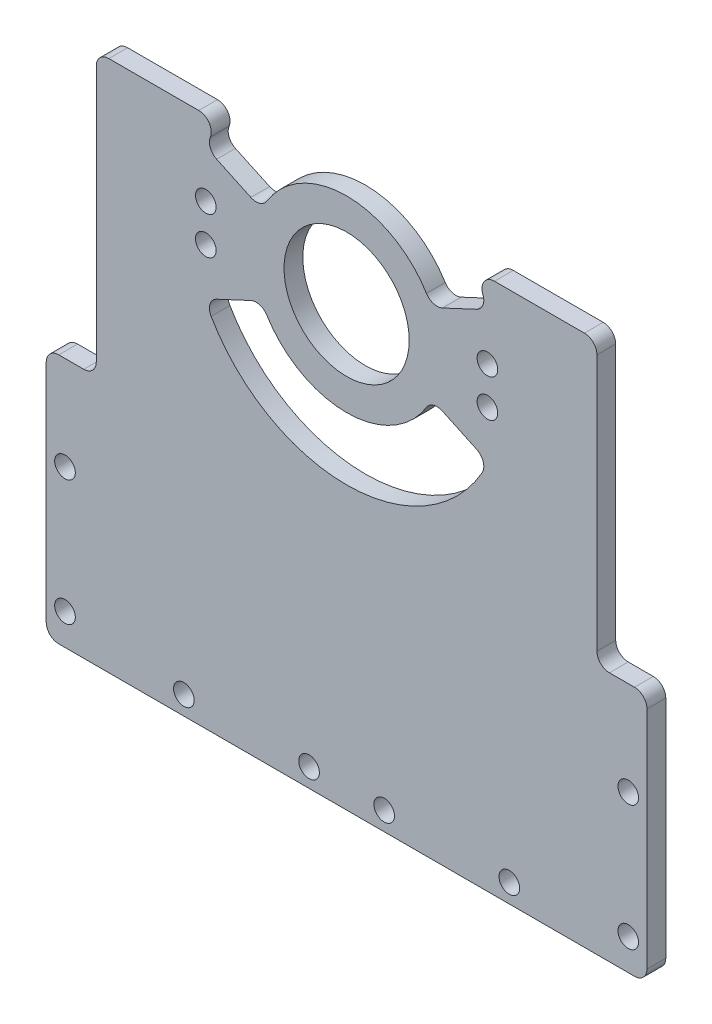
from build123d import *

# Parameters (mm, degrees)
SKETCH_1_W          = 80
SKETCH_1_H          = 85
SKETCH_1_R          = 10
SKETCH_1_R_2        = 1.65
EXTRUDE_1_DEPTH     = 3
CUT_EXTRUDE_1_DEPTH = 59.440140315
SKETCH_3_W          = 8
SKETCH_3_H          = 40
EXTRUDE_2_DEPTH     = 3
SKETCH_4_R          = 1.65
CUT_EXTRUDE_2_DEPTH = 65.181383594
FILLET_1_R          = 2
FILLET_2_R          = 2


with BuildPart() as part:
    # 草图1 → 凸台-拉伸1 (new body)
    with BuildSketch(Plane.XY):
        Rectangle(SKETCH_1_W, SKETCH_1_H)
        with Locations((0, 27.5)):
            Circle(SKETCH_1_R, mode=Mode.SUBTRACT)
        with Locations((-6, -39.5)):
            Circle(SKETCH_1_R_2, mode=Mode.SUBTRACT)
        with Locations((-26, -39.5)):
            Circle(SKETCH_1_R_2, mode=Mode.SUBTRACT)
        with Locations((26, -39.5)):
            Circle(SKETCH_1_R_2, mode=Mode.SUBTRACT)
        with Locations((6, -39.5)):
            Circle(SKETCH_1_R_2, mode=Mode.SUBTRACT)
        with Locations((-22.5, 30.5)):
            Circle(SKETCH_1_R_2, mode=Mode.SUBTRACT)
        with Locations((-22.5, 24.5)):
            Circle(SKETCH_1_R_2, mode=Mode.SUBTRACT)
        with Locations((22.5, 30.5)):
            Circle(SKETCH_1_R_2, mode=Mode.SUBTRACT)
        with Locations((22.5, 24.5)):
            Circle(SKETCH_1_R_2, mode=Mode.SUBTRACT)
    extrude(amount=EXTRUDE_1_DEPTH)

    # 草图2 → 切除-拉伸1 (cut, through all)
    with BuildSketch(Plane.XY.offset(3)):
        with BuildLine():
            Line((22.657694676, 16.934543456), (13.594616806, 21.160726074))
            ThreePointArc((13.594616806, 21.160726074), (0, 12.5), (-13.594616806, 21.160726074))
            Line((-13.594616806, 21.160726074), (-22.657694676, 16.934543456))
            ThreePointArc((-22.657694676, 16.934543456), (0, 2.5), (22.657694676, 16.934543456))
        make_face()
        with BuildLine():
            Line((-22.657694676, 38.065456544), (-13.594616806, 33.839273926))
            ThreePointArc((-13.594616806, 33.839273926), (0, 42.5), (13.594616806, 33.839273926))
            Line((13.594616806, 33.839273926), (22.657694676, 38.065456544))
            ThreePointArc((22.657694676, 38.065456544), (0, 52.5), (-22.657694676, 38.065456544))
        make_face()
    extrude(amount=-CUT_EXTRUDE_1_DEPTH, mode=Mode.SUBTRACT)

    # 草图3 → 凸台-拉伸2 (add)
    with BuildSketch(Plane.XY.offset(3)):
        with Locations((44, -22.5)):
            Rectangle(SKETCH_3_W, SKETCH_3_H)
        with Locations((-44, -22.5)):
            Rectangle(SKETCH_3_W, SKETCH_3_H)
    extrude(amount=-EXTRUDE_2_DEPTH)

    # 草图4 → 切除-拉伸2 (cut, through all)
    with BuildSketch(Plane.XY.offset(3)):
        with Locations((45, -37.5)):
            Circle(SKETCH_4_R)
        with Locations((45, -17.5)):
            Circle(SKETCH_4_R)
        with Locations((-45, -17.5)):
            Circle(SKETCH_4_R)
        with Locations((-45, -37.5)):
            Circle(SKETCH_4_R)
    extrude(amount=-CUT_EXTRUDE_2_DEPTH, mode=Mode.SUBTRACT)

    # 圆角1
    fillet_1_edges = [part.edges().sort_by_distance(p)[0] for p in [
        (-40, 42.5, 1.5),
        (22.657694676, 16.934543456, 1.5),
        (-22.657694676, 16.934543456, 1.5),
        (13.594616806, 21.160726074, 1.5),
        (-13.594616806, 21.160726074, 1.5),
        (-22.657694676, 38.065456544, 1.5),
        (-13.594616806, 33.839273926, 1.5),
        (13.594616806, 33.839273926, 1.5),
        (22.657694676, 38.065456544, 1.5),
        (-48, -2.5, 1.5),
        (40, -2.5, 1.5),
        (48, -2.5, 1.5),
    ]]
    fillet(fillet_1_edges, radius=FILLET_1_R)

    # 圆角2
    fillet_2_edges = [part.edges().sort_by_distance(p)[0] for p in [
        (-20, 42.5, 1.5),
        (40, 42.5, 1.5),
        (-48, -42.5, 1.5),
        (48, -42.5, 1.5),
        (20, 42.5, 1.5),
        (-40, -2.5, 1.5),
    ]]
    fillet(fillet_2_edges, radius=FILLET_2_R)


solid = part.part
